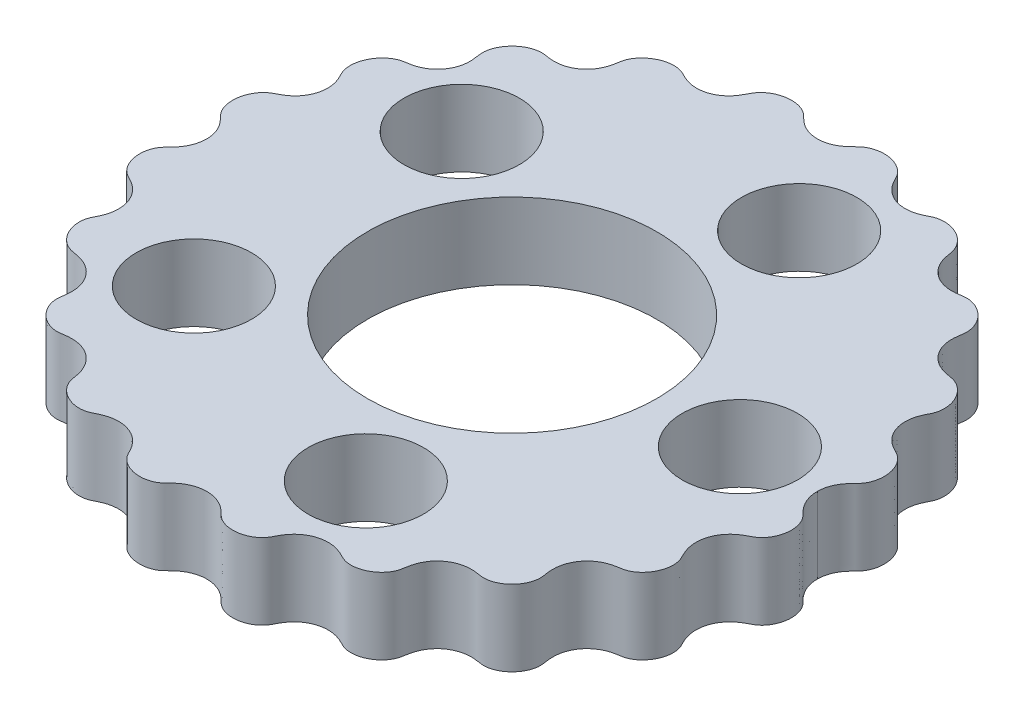
from build123d import *

# Parameters (mm, degrees)
BOSS_EXTRUDE1_START = 0.5
MAIN_R              = 3.8
MAIN_R_2            = 9.525
BOSS_EXTRUDE1_DEPTH = 5


with BuildPart() as part:
    # MAIN → Boss-Extrude1 (new body)
    with BuildSketch(Plane(origin=(0, 0, 0), x_dir=(1, 0, 0), z_dir=(0, 1, 0)).offset(BOSS_EXTRUDE1_START)):
        with BuildLine():
            add(Edge.make_bspline(
                [(20.1, 0), (20.1, 0.016049474), (20.10042819, 0.048265255), (20.102997256, 0.122217827), (20.111980932, 0.241772144), (20.129908594, 0.365784261), (20.160482731, 0.510263145), (20.200949467, 0.651927408), (20.251052975, 0.790295326), (20.310457626, 0.925031815), (20.405026773, 1.105489785), (20.522557341, 1.284294211), (20.663651728, 1.457905797), (20.825054173, 1.626232115), (20.958535869, 1.756480173), (21.084001151, 1.894913118), (21.19070215, 2.048527229), (21.322181138, 2.295585844), (21.436381782, 2.652555263), (21.480312105, 3.117719001), (21.403906438, 3.600484736), (21.255410516, 3.988503115), (21.088113178, 4.266212931), (20.940586592, 4.45153473), (20.783892784, 4.60313609), (20.624163597, 4.722840948), (20.449787935, 4.819202), (20.27144251, 4.907182077), (20.053826972, 5.02775347), (19.772663447, 5.220092779), (19.460268988, 5.522133789), (19.170367617, 5.979141351), (19.000054809, 6.550986456), (18.996788488, 7.09347867), (19.100354653, 7.522100535), (19.22600522, 7.825047936), (19.323069978, 8.019726709), (19.403208808, 8.17418946), (19.489181816, 8.374410265), (19.566475444, 8.682529861), (19.577864851, 9.101072271), (19.464679992, 9.610899865), (19.231249329, 10.06169528), (18.951631481, 10.396325325), (18.687316384, 10.612198661), (18.478605363, 10.738828373), (18.27672622, 10.826592284), (18.088022057, 10.880549413), (17.894642882, 10.91173651), (17.701344091, 10.941923543), (17.509848243, 10.983109484), (17.321856927, 11.038173185), (17.054914968, 11.140977964), (16.724922472, 11.324678262), (16.36394906, 11.636125273), (16.04411147, 12.112470544), (15.877508027, 12.614075001), (15.840960492, 13.04599222), (15.865791708, 13.378406904), (15.901121962, 13.611045435), (15.931904955, 13.796812252), (15.948155089, 14.03214825), (15.914834064, 14.353727504), (15.78710039, 14.744710058), (15.520698222, 15.177621098), (15.172973033, 15.516306183), (14.815895064, 15.740926601), (14.502994467, 15.864191931), (14.267579789, 15.921315139), (14.048828919, 15.944131552), (13.851076664, 15.938715819), (13.655902731, 15.909039398), (13.461304909, 15.877385295), (13.264984922, 15.856779828), (13.067674425, 15.850574212), (12.776173172, 15.865678978), (12.395590433, 15.940956671), (11.938569212, 16.137109085), (11.470553416, 16.519893429), (11.162879572, 16.97049216), (11.008945031, 17.382763009), (10.941723246, 17.700684498), (10.909391818, 17.910609622), (10.88131532, 18.078311006), (10.825896286, 18.28384026), (10.700795847, 18.566487319), (10.463238575, 18.896536387), (10.10649369, 19.20329467), (9.672270844, 19.42958383), (9.232677179, 19.551096678), (8.86266136, 19.576275628), (8.573868633, 19.540840142), (8.371319786, 19.482977256), (8.233500913, 19.429263516), (8.108846995, 19.36980218), (7.971859121, 19.298414607), (7.817815897, 19.224247184), (7.620319341, 19.142348296), (7.375175899, 19.065537121), (7.059284278, 19.008648031), (6.674311347, 19.005623312), (6.23487299, 19.085333044), (5.767240847, 19.286472452), (5.38043875, 19.585271088), (5.114615337, 19.91251743), (4.953608216, 20.183713005), (4.838337688, 20.408845665), (4.72360429, 20.635366187), (4.500791609, 20.915757491), (4.133761058, 21.194811415), (3.650572556, 21.401524152), (3.141425397, 21.474182478), (2.701085807, 21.439094531), (2.367723237, 21.345707693), (2.140403794, 21.245160735), (1.970791827, 21.139493932), (1.852684175, 21.04557956), (1.760619588, 20.960149721), (1.689220401, 20.8894654), (1.618180579, 20.81844632), (1.5460278, 20.748562596), (1.453458035, 20.663707945), (1.33785031, 20.566946935), (1.195706387, 20.46317673), (0.944410243, 20.311151454), (0.586883972, 20.160779511), (0.097411097, 20.067712928), (-0.506706748, 20.123705295), (-1.010623007, 20.324911261), (-1.364703608, 20.576832472), (-1.593509044, 20.792533664), (-1.731815119, 20.932868041), (-1.846227845, 21.041471908), (-2.001916865, 21.162825929), (-2.254686782, 21.308029569), (-2.62139071, 21.431603659), (-3.111950077, 21.479440319), (-3.664222652, 21.395690883), (-4.133751672, 21.194811679), (-4.50079738, 20.915757334), (-4.723600954, 20.635366277), (-4.838339701, 20.408845611), (-4.95360724, 20.183713031), (-5.114615975, 19.912517413), (-5.380438356, 19.585271099), (-5.767241074, 19.286472446), (-6.23487286, 19.085333048), (-6.674311426, 19.00562331), (-7.059284219, 19.008648033), (-7.37517594, 19.06553712), (-7.620319317, 19.142348297), (-7.817815908, 19.224247184), (-7.971859116, 19.298414607), (-8.108846996, 19.36980218), (-8.233500913, 19.429263515), (-8.371319785, 19.482977259), (-8.573868636, 19.540840136), (-8.862661354, 19.57627564), (-9.232677188, 19.551096661), (-9.672270832, 19.429583855), (-10.106493713, 19.203294623), (-10.463238537, 18.896536464), (-10.7007959, 18.566487209), (-10.825896203, 18.283840429), (-10.881315502, 18.078310633), (-10.909391314, 17.910610649), (-10.941724273, 17.700682406), (-11.008943, 17.382767148), (-11.162882957, 16.970485259), (-11.470548885, 16.519902665), (-11.938575656, 16.137095951), (-12.441451846, 15.92129044), (-12.874268252, 15.849349026), (-13.215931604, 15.851574086), (-13.461292159, 15.877411282), (-13.65590942, 15.909025764), (-13.851073848, 15.938721557), (-14.048830186, 15.944128969), (-14.267579135, 15.921316472), (-14.502994784, 15.864191285), (-14.815894857, 15.740927023), (-15.172973177, 15.516305889), (-15.520698126, 15.177621293), (-15.787100449, 14.744709937), (-15.914834028, 14.353727576), (-15.948155108, 14.032148211), (-15.931904943, 13.796812277), (-15.901121967, 13.611045423), (-15.865791705, 13.37840691), (-15.840960494, 13.045992217), (-15.877508026, 12.614075003), (-16.044111471, 12.112470543), (-16.363949059, 11.636125274), (-16.724922472, 11.324678262), (-17.054914968, 11.140977965), (-17.321856927, 11.038173185), (-17.509848243, 10.983109484), (-17.701344091, 10.941923543), (-17.894642882, 10.911736511), (-18.088022057, 10.880549413), (-18.27672622, 10.826592284), (-18.478605363, 10.738828373), (-18.687316384, 10.612198661), (-18.951631481, 10.396325326), (-19.231249329, 10.06169528), (-19.464679992, 9.610899865), (-19.577864851, 9.101072271), (-19.566475444, 8.682529861), (-19.489181816, 8.374410265), (-19.403208808, 8.17418946), (-19.323069978, 8.01972671), (-19.22600522, 7.825047936), (-19.100354653, 7.522100535), (-18.996788488, 7.093478671), (-19.000054809, 6.550986456), (-19.170367616, 5.979141351), (-19.460268988, 5.52213379), (-19.772663447, 5.220092779), (-20.053826972, 5.027753471), (-20.27144251, 4.907182077), (-20.449787935, 4.819202), (-20.624163597, 4.722840949), (-20.783892784, 4.60313609), (-20.940586592, 4.45153473), (-21.088113178, 4.266212931), (-21.255410516, 3.988503115), (-21.403906438, 3.600484737), (-21.480312105, 3.117719001), (-21.436381782, 2.652555264), (-21.322181138, 2.295585843), (-21.19070215, 2.048527232), (-21.084001151, 1.894913113), (-20.958535869, 1.756480188), (-20.825054173, 1.626232085), (-20.663651728, 1.45790587), (-20.522557341, 1.284294066), (-20.405026773, 1.105490041), (-20.310457626, 0.9250314), (-20.251052975, 0.790296167), (-20.200949467, 0.651926266), (-20.16048273, 0.510264245), (-20.129908594, 0.365772489), (-20.111980932, 0.24187695), (-20.102997255, 0.121794435), (-20.100428187, 0.048465762), (-20.1, 0.016049475), (-20.1, -0.02171016), (-20.100740365, -0.065537224), (-20.104071934, -0.144156063), (-20.112945474, -0.24888272), (-20.129548599, -0.371521199), (-20.158221265, -0.515938033), (-20.204239041, -0.684918351), (-20.273520329, -0.870557648), (-20.358752691, -1.050317426), (-20.458985655, -1.221772432), (-20.566593118, -1.375373307), (-20.677800781, -1.512107496), (-20.78907177, -1.633996227), (-20.89729475, -1.743281226), (-21.006487753, -1.851660443), (-21.108826998, -1.966746908), (-21.220223107, -2.123936398), (-21.346640876, -2.369339666), (-21.448804421, -2.714922855), (-21.479569019, -3.150863822), (-21.406738099, -3.6189376), (-21.253503208, -4.010050586), (-21.054801466, -4.3167693), (-20.834568393, -4.54681101), (-20.612263971, -4.704344178), (-20.325273755, -4.839756744), (-20.00852218, -5.01868956), (-19.684333315, -5.273417476), (-19.386374063, -5.622567486), (-19.165380649, -6.023790243), (-19.031235387, -6.460667693), (-18.988554194, -6.914383703), (-19.031153524, -7.309949886), (-19.121535833, -7.637383735), (-19.231185759, -7.907699698), (-19.340003931, -8.125599511), (-19.458279678, -8.349696035), (-19.534342307, -8.60201151), (-19.571226544, -8.910170929), (-19.547468686, -9.268289446), (-19.441274763, -9.663411072), (-19.230677135, -10.071117867), (-18.962617101, -10.393930449), (-18.69456545, -10.607356203), (-18.463252178, -10.732656246), (-18.290990166, -10.798741664), (-18.148391024, -10.836569426), (-18.003178925, -10.861951575), (-17.857558256, -10.884265091), (-17.641121776, -10.923327988), (-17.357371949, -10.996845119), (-17.017888737, -11.137017594), (-16.649928165, -11.379284126), (-16.334369672, -11.690450594), (-16.08502107, -12.060144405), (-15.913420845, -12.474413535), (-15.837321702, -12.861692439), (-15.826145974, -13.198469455), (-15.849040745, -13.486913028), (-15.886691352, -13.72544992), (-15.927162315, -13.973460833), (-15.917763897, -14.234537693), (-15.855442161, -14.535749675), (-15.720933739, -14.865237104), (-15.494128005, -15.210409224), (-15.157431132, -15.538376323), (-14.781408984, -15.76822783), (-14.431758379, -15.886583939), (-14.146771031, -15.923570894), (-13.940431266, -15.917988379), (-13.777045476, -15.895710114), (-13.573931264, -15.861918407), (-13.311432759, -15.830171544), (-12.987810263, -15.826054921), (-12.60914423, -15.881308187), (-12.229522049, -16.007230154), (-11.876954427, -16.1993096), (-11.563437142, -16.452525279), (-11.299633908, -16.759177641), (-11.094221009, -17.109263485), (-10.975435401, -17.427961134), (-10.912460643, -17.694217159), (-10.877730043, -17.89918615), (-10.856064449, -18.0401656), (-10.822771699, -18.215436473), (-10.756071908, -18.419634752), (-10.618321052, -18.683058453), (-10.378992613, -18.978083153), (-10.050155805, -19.245203321), (-9.632890947, -19.453548744), (-9.223494552, -19.555845862), (-8.883602633, -19.569595951), (-8.624829389, -19.53453372), (-8.448145167, -19.486752645), (-8.311702249, -19.433795975), (-8.180359463, -19.369482763), (-8.050463002, -19.302491925), (-7.848916598, -19.205079035), (-7.567592994, -19.094767002), (-7.195942419, -19.007772682), (-6.736051918, -18.99379513), (-6.286118287, -19.073202806), (-5.86481401, -19.240976426), (-5.488630496, -19.487915279), (-5.210069989, -19.761933205), (-5.011673366, -20.030377918), (-4.88402849, -20.249288085), (-4.804678509, -20.403650404), (-4.722737461, -20.564714017), (-4.627134448, -20.726897435), (-4.486551992, -20.896721045), (-4.26137917, -21.094571853), (-3.962456049, -21.275011587), (-3.592508535, -21.411382192), (-3.15817733, -21.475362584), (-2.768745757, -21.452327592), (-2.437761406, -21.369500955), (-2.168271589, -21.248422688), (-1.958055932, -21.110173628), (-1.785447744, -20.94091701), (-1.622730612, -20.775668556), (-1.414624707, -20.592569598), (-1.152020167, -20.405823234), (-0.814799819, -20.236460165), (-0.395794796, -20.11756634), (0.04306138, -20.082050137), (0.484607542, -20.134421982), (0.91116178, -20.274957645), (1.271012064, -20.478453824), (1.534676394, -20.691199523), (1.722859475, -20.876678362), (1.857461379, -21.012098347), (1.972236287, -21.113107357), (2.128810544, -21.222996315), (2.369691528, -21.346150999), (2.705938739, -21.446074355), (3.128997453, -21.478869711), (3.583297764, -21.414776575), (3.962473712, -21.275005607), (4.261368893, -21.094575333), (4.486558386, -20.89671888), (4.627130565, -20.726898749), (4.722739327, -20.564713386), (4.804677846, -20.403650629), (4.884028711, -20.249288011), (5.011673252, -20.030377957), (5.210070055, -19.761933183), (5.488630456, -19.487915292), (5.864814032, -19.240976419), (6.286118273, -19.073202811), (6.736051926, -18.993795127), (7.195942412, -19.007772684), (7.567592997, -19.094767), (7.848916597, -19.205079036), (8.050463002, -19.302491925), (8.180359447, -19.369482757), (8.311702337, -19.433796008), (8.448144957, -19.486752569), (8.624829844, -19.534533887), (8.883601698, -19.569595609), (9.22349619, -19.555846462), (9.632888472, -19.453547838), (10.050159599, -19.245204711), (10.378986666, -18.978080976), (10.61833073, -18.683061996), (10.756055979, -18.419628921), (10.822802865, -18.215447882), (10.862648263, -18.005084067), (10.897177746, -17.764021208), (10.9630027, -17.461561655), (11.094176446, -17.109247173), (11.299658013, -16.759186465), (11.563423205, -16.452520178), (11.876963914, -16.199313073), (12.229515738, -16.007227845), (12.609148784, -15.881309854), (12.987807102, -15.826053764), (13.311434593, -15.830172215), (13.57393037, -15.861918081), (13.777045847, -15.895710251), (13.940431152, -15.917988338), (14.14677108, -15.923570912), (14.431758349, -15.886583928), (14.781409003, -15.768227837), (15.15743112, -15.53837632), (15.494128012, -15.210409227), (15.720933734, -14.865237102), (15.855442163, -14.535749676), (15.917763895, -14.234537693), (15.927162316, -13.973460834), (15.886691351, -13.72544992), (15.849040745, -13.486913028), (15.826145973, -13.198469455), (15.837321702, -12.861692439), (15.913420844, -12.474413536), (16.085021069, -12.060144406), (16.334369672, -11.690450595), (16.649928164, -11.379284126), (17.017888736, -11.137017594), (17.357371949, -10.99684512), (17.641121776, -10.923327988), (17.857558256, -10.884265091), (18.003178929, -10.86195157), (18.148391004, -10.836569454), (18.290990211, -10.798741599), (18.463252081, -10.732656387), (18.694565648, -10.607355915), (18.96261675, -10.393930958), (19.23067766, -10.071117106), (19.441273966, -9.663412226), (19.54746991, -9.268287674), (19.571224635, -8.910173694), (19.534345549, -8.602006815), (19.458272769, -8.34970604), (19.340018236, -8.125578794), (19.231160509, -7.907736265), (19.14282673, -7.689724945), (19.076304167, -7.473725478), (19.019020301, -7.196875925), (18.993846489, -6.857849588), (19.031255544, -6.460638503), (19.165368749, -6.023807477), (19.386381461, -5.622556771), (19.684328371, -5.273424636), (20.008525148, -5.018685262), (20.325272171, -4.839759039), (20.612264677, -4.704343157), (20.834568029, -4.546811538), (21.054801685, -4.316768984), (21.253503069, -4.010050789), (21.40673819, -3.618937469), (21.479568958, -3.150863911), (21.448804463, -2.714922796), (21.346640853, -2.3693397), (21.220223118, -2.123936381), (21.108826992, -1.966746916), (21.006487755, -1.85166044), (20.897294749, -1.743281222), (20.78907177, -1.633996261), (20.677800781, -1.512107366), (20.566593118, -1.375373687), (20.458985655, -1.221771519), (20.358752691, -1.050319311), (20.273520329, -0.870553985), (20.204239041, -0.684923618), (20.158221265, -0.5159414), (20.129548599, -0.371490762), (20.112945473, -0.248940239), (20.104071929, -0.144509512), (20.100740368, -0.065175164), (20.1, -0.021710161), (20.1, 0)],
                knots=[0.063609002, 0.063609002, 0.063609002, 0.063609002, 0.063609002, 0.064458074, 0.065307146, 0.06700529, 0.068703435, 0.070401579, 0.072099723, 0.073797867, 0.075496012, 0.077194156, 0.081499833, 0.083652672, 0.085805511, 0.087958349, 0.090111188, 0.092264027, 0.094416865, 0.100851345, 0.107285824, 0.113598849, 0.116755361, 0.119911874, 0.122207841, 0.124503809, 0.126799776, 0.129095744, 0.131391711, 0.133687679, 0.138279613, 0.144786754, 0.151293894, 0.158381972, 0.16547005, 0.169487075, 0.171495587, 0.1735041, 0.175512612, 0.177521124, 0.181538149, 0.188088893, 0.194639636, 0.201358698, 0.204718229, 0.20807776, 0.210336636, 0.212595511, 0.214854386, 0.217113262, 0.219372137, 0.221631013, 0.223889888, 0.226148764, 0.232563486, 0.238978207, 0.245649795, 0.252321382, 0.256667064, 0.258839905, 0.261012746, 0.263185587, 0.265358428, 0.269704109, 0.275848778, 0.281993447, 0.288591296, 0.291890221, 0.295189145, 0.297465562, 0.29974198, 0.302018397, 0.304294814, 0.306571231, 0.308847648, 0.311124065, 0.313400483, 0.320031256, 0.32666203, 0.333803829, 0.340945629, 0.344868761, 0.346830327, 0.348791893, 0.350753459, 0.352715025, 0.356638156, 0.362992656, 0.369347155, 0.374206536, 0.379065918, 0.383918614, 0.386344962, 0.387558136, 0.38877131, 0.390744311, 0.392717312, 0.394690313, 0.396663314, 0.400609317, 0.404555319, 0.409450074, 0.414344829, 0.421090178, 0.427835527, 0.431732176, 0.433680501, 0.435628826, 0.439525475, 0.443422124, 0.450061542, 0.456700961, 0.46350218, 0.46690279, 0.4703034, 0.472622355, 0.47494131, 0.476100788, 0.477260265, 0.478419743, 0.479579221, 0.480738698, 0.481898176, 0.484217131, 0.486536087, 0.488855042, 0.495440463, 0.502025885, 0.509259804, 0.516493724, 0.520132717, 0.521952213, 0.523771709, 0.525591206, 0.527410702, 0.531049695, 0.537174367, 0.543299039, 0.549938458, 0.556577876, 0.560474525, 0.564371174, 0.566319499, 0.568267824, 0.572164473, 0.578909822, 0.585655171, 0.590549926, 0.595444681, 0.599390683, 0.603336686, 0.605309687, 0.607282688, 0.609255689, 0.61122869, 0.612441864, 0.613655038, 0.616081386, 0.620934082, 0.625793464, 0.630652845, 0.637007344, 0.643361844, 0.647284975, 0.649246541, 0.651208107, 0.653169673, 0.655131239, 0.659054371, 0.666196171, 0.67333797, 0.679968744, 0.686599517, 0.691152352, 0.693428769, 0.695705186, 0.697981603, 0.70025802, 0.702534438, 0.704810855, 0.708109779, 0.711408704, 0.718006553, 0.724151222, 0.730295891, 0.734641572, 0.736814413, 0.738987254, 0.741160095, 0.743332936, 0.747678618, 0.754350205, 0.761021793, 0.767436514, 0.773851236, 0.776110112, 0.778368987, 0.780627863, 0.782886738, 0.785145614, 0.787404489, 0.789663364, 0.79192224, 0.795281771, 0.798641302, 0.805360364, 0.811911107, 0.818461851, 0.822478876, 0.824487388, 0.8264959, 0.828504413, 0.830512925, 0.83452995, 0.841618028, 0.848706106, 0.855213246, 0.861720387, 0.866312321, 0.868608289, 0.870904256, 0.873200224, 0.875496191, 0.877792159, 0.880088126, 0.883244639, 0.886401151, 0.892714176, 0.899148655, 0.905583135, 0.907735973, 0.909888812, 0.912041651, 0.914194489, 0.916347328, 0.918500167, 0.922805844, 0.924503988, 0.926202133, 0.927900277, 0.929598421, 0.931296565, 0.93299471, 0.934692854, 0.935541926, 0.936390998, 0.936390998, 0.936390998, 0.93753954, 0.938688082, 0.939836624, 0.940985165, 0.943282249, 0.945579333, 0.947876416, 0.9501735, 0.952470583, 0.954767667, 0.956547976, 0.958328284, 0.960108593, 0.961888902, 0.96366921, 0.965449519, 0.969010136, 0.974615965, 0.980221794, 0.985496461, 0.990771127, 0.993903217, 0.997035308, 1.000167399, 1.00329949, 1.008576822, 1.013854154, 1.019131487, 1.024408819, 1.029635531, 1.034862243, 1.040088955, 1.042702312, 1.045315668, 1.048344949, 1.05137423, 1.054403511, 1.057432793, 1.06265791, 1.067883028, 1.073200187, 1.078517346, 1.081927608, 1.083632739, 1.08533787, 1.087043002, 1.088748133, 1.090453264, 1.092158395, 1.097225308, 1.102292221, 1.107359134, 1.112426048, 1.117611695, 1.122797343, 1.127982991, 1.130575815, 1.133168639, 1.136171384, 1.139174129, 1.142176874, 1.145179619, 1.150361937, 1.155544256, 1.161155886, 1.166767516, 1.170581224, 1.172488079, 1.174394933, 1.176301787, 1.178208641, 1.18202235, 1.186627433, 1.191232516, 1.195837599, 1.200442682, 1.205116059, 1.209789435, 1.214462812, 1.219136189, 1.220786941, 1.222437693, 1.224088444, 1.225739196, 1.2290407, 1.232342203, 1.237773978, 1.243205753, 1.24848755, 1.253769348, 1.2571526, 1.258844225, 1.260535851, 1.262227477, 1.263919103, 1.265610729, 1.267302354, 1.272591297, 1.27788024, 1.283169183, 1.288458126, 1.293594209, 1.298730291, 1.303866374, 1.306434415, 1.309002456, 1.310452146, 1.311901836, 1.314801216, 1.317700595, 1.320599975, 1.325733449, 1.330866922, 1.335823509, 1.340780095, 1.343673181, 1.346566267, 1.349459352, 1.352352438, 1.354832904, 1.357313371, 1.362274305, 1.367235238, 1.372196172, 1.377359301, 1.382522431, 1.387685561, 1.39284869, 1.396383657, 1.39815114, 1.399918623, 1.401686106, 1.403453589, 1.406988556, 1.412394883, 1.41780121, 1.422934684, 1.428068158, 1.430967537, 1.433866917, 1.436766297, 1.438215987, 1.439665676, 1.442233718, 1.444801759, 1.449937841, 1.455073924, 1.460210007, 1.465498949, 1.470787892, 1.476076835, 1.481365778, 1.483057404, 1.48474903, 1.486440656, 1.488132281, 1.489823907, 1.491515533, 1.494898785, 1.500180582, 1.50546238, 1.510894155, 1.516325929, 1.519627433, 1.522928937, 1.524579688, 1.52623044, 1.529531944, 1.53420532, 1.538878697, 1.543552074, 1.548225451, 1.552830534, 1.557435617, 1.5620407, 1.566645783, 1.570459491, 1.572366345, 1.5742732, 1.576180054, 1.578086908, 1.581900617, 1.587512247, 1.593123877, 1.598306195, 1.603488514, 1.606491259, 1.609494004, 1.612496749, 1.615499494, 1.618092318, 1.620685142, 1.625870789, 1.631056437, 1.636242085, 1.641308998, 1.646375911, 1.651442825, 1.656509738, 1.658214869, 1.65992, 1.661625131, 1.663330262, 1.665035393, 1.666740524, 1.670150786, 1.675467945, 1.680785105, 1.686010222, 1.69123534, 1.694264621, 1.697293903, 1.700323184, 1.703352465, 1.705965821, 1.708579177, 1.711192533, 1.713805889, 1.719032601, 1.724259314, 1.729536646, 1.734813978, 1.740091311, 1.745368643, 1.748500734, 1.751632824, 1.754764915, 1.757897006, 1.763171672, 1.768446338, 1.774052167, 1.779657997, 1.783218614, 1.784998922, 1.786779231, 1.78855954, 1.790339848, 1.792120157, 1.793900466, 1.796197549, 1.798494633, 1.800791716, 1.8030888, 1.805385884, 1.807682967, 1.808831509, 1.809980051, 1.811128593, 1.812277134, 1.812277134, 1.812277134, 1.812277134, 1.812277134], degree=4))
        make_face()
        with Locations((15, 0)):
            Circle(MAIN_R, mode=Mode.SUBTRACT)
        with Locations((4.635254916, -14.265847744)):
            Circle(MAIN_R, mode=Mode.SUBTRACT)
        with Locations((-12.135254916, -8.816778784)):
            Circle(MAIN_R, mode=Mode.SUBTRACT)
        with Locations((-12.135254916, 8.816778784)):
            Circle(MAIN_R, mode=Mode.SUBTRACT)
        with Locations((4.635254916, 14.265847744)):
            Circle(MAIN_R, mode=Mode.SUBTRACT)
        Circle(MAIN_R_2, mode=Mode.SUBTRACT)
    extrude(amount=BOSS_EXTRUDE1_DEPTH)


solid = part.part
